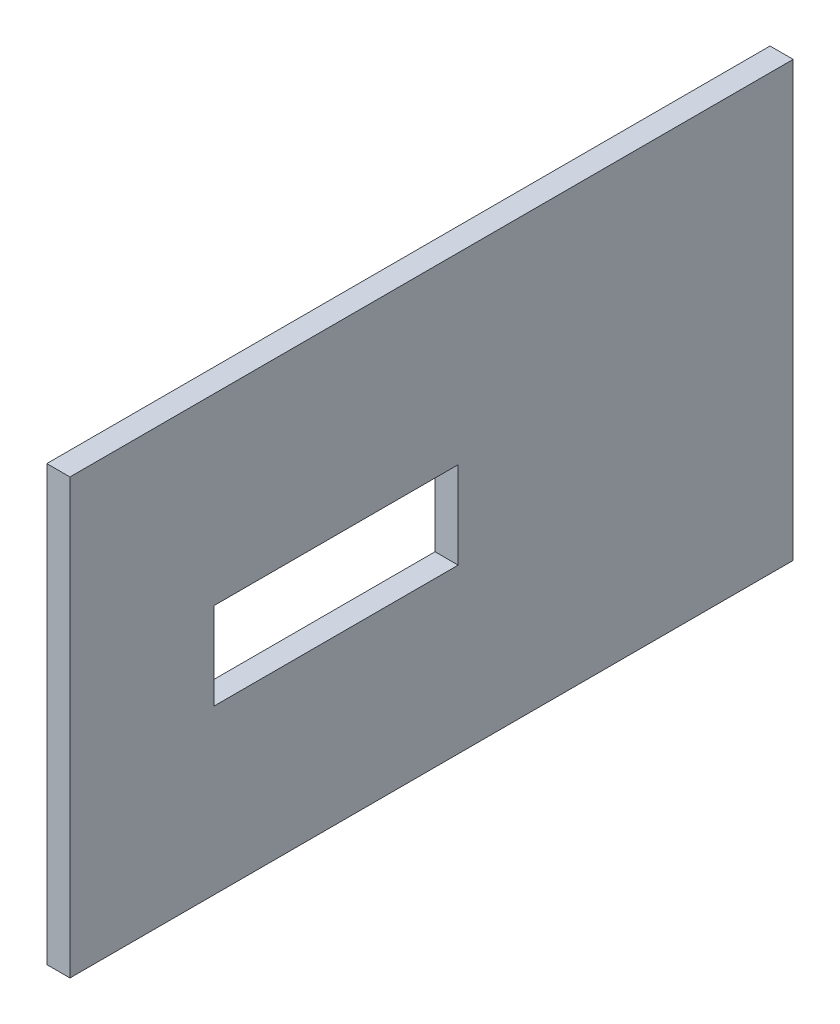
from build123d import *

# Parameters (mm, degrees)
SKETCH2_W           = 100
SKETCH2_H           = 60
BOSS_EXTRUDE1_DEPTH = 3.2
SKETCH3_W           = 33.775934958
SKETCH3_H           = 12.031198928
CUT_EXTRUDE1_DEPTH  = 3.2


with BuildPart() as part:
    # Sketch2 → Boss-Extrude1 (new body)
    with BuildSketch(Plane(origin=(0, 0, 0), x_dir=(0, 0, -1), z_dir=(1, 0, 0))):
        with Locations((-51.063551639, 7.4)):
            Rectangle(SKETCH2_W, SKETCH2_H)
    extrude(amount=BOSS_EXTRUDE1_DEPTH)

    # Sketch3 → Cut-Extrude1 (cut)
    with BuildSketch(Plane(origin=(3.2, 0, 0), x_dir=(0, 0, -1), z_dir=(1, 0, 0))):
        with Locations((-64.275689578, 6.015599464)):
            Rectangle(SKETCH3_W, SKETCH3_H)
    extrude(amount=-CUT_EXTRUDE1_DEPTH, mode=Mode.SUBTRACT)


solid = part.part
